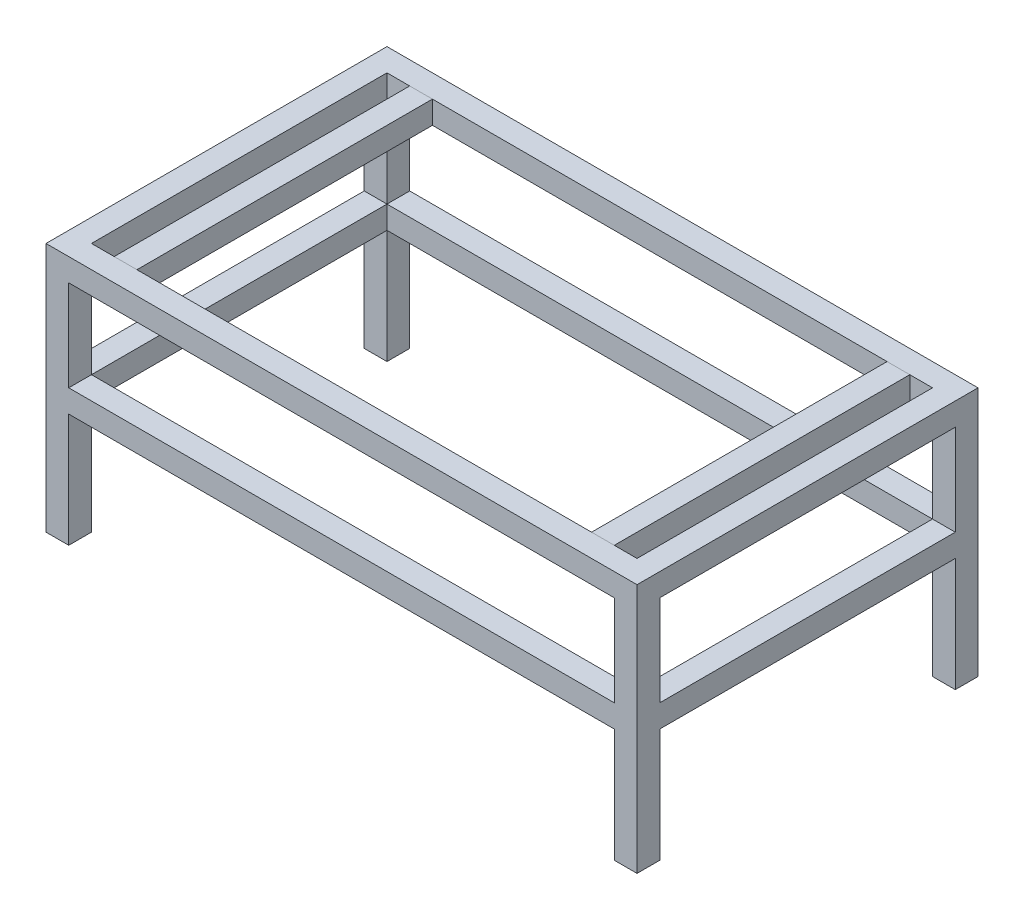
from build123d import *

# Parameters (mm, degrees)
ESQUISSE1_W             = 1300
ESQUISSE1_H             = 750
ESQUISSE1_W_2           = 1200
ESQUISSE1_H_2           = 650
BOSS_EXTRU_1_DEPTH      = 550
ESQUISSE2_W             = 1200
ESQUISSE2_H             = 200
ESQUISSE2_H_2           = 250
ENL_V_MAT_EXTRU_1_DEPTH = 1599.436736315
ESQUISSE3_W             = 650
ESQUISSE3_H             = 200
ESQUISSE3_H_2           = 250
ENL_V_MAT_EXTRU_2_DEPTH = 1599.436736315
ESQUISSE4_W             = 50
ESQUISSE4_H             = 650
BOSS_EXTRU_2_DEPTH      = 50
BOSS_EXTRU_2_2_DEPTH    = 50


with BuildPart() as part:
    # Esquisse1 → Boss.-Extru.1 (new body)
    with BuildSketch(Plane(origin=(0, 0, 0), x_dir=(1, 0, 0), z_dir=(0, 1, 0))):
        with Locations((650, 375)):
            Rectangle(ESQUISSE1_W, ESQUISSE1_H)
        with Locations((650, 375)):
            Rectangle(ESQUISSE1_W_2, ESQUISSE1_H_2, mode=Mode.SUBTRACT)
    extrude(amount=-BOSS_EXTRU_1_DEPTH)

    # Esquisse2 → Enlèv. mat.-Extru.1 (cut, through all)
    with BuildSketch(Plane.XY):
        with Locations((650, -150)):
            Rectangle(ESQUISSE2_W, ESQUISSE2_H)
        with Locations((650, -425)):
            Rectangle(ESQUISSE2_W, ESQUISSE2_H_2)
    extrude(amount=-ENL_V_MAT_EXTRU_1_DEPTH, mode=Mode.SUBTRACT)

    # Esquisse3 → Enlèv. mat.-Extru.2 (cut, through all)
    with BuildSketch(Plane.ZY):
        with Locations((-375, -150)):
            Rectangle(ESQUISSE3_W, ESQUISSE3_H)
        with Locations((-375, -425)):
            Rectangle(ESQUISSE3_W, ESQUISSE3_H_2)
    extrude(amount=-ENL_V_MAT_EXTRU_2_DEPTH, mode=Mode.SUBTRACT)


with BuildPart() as body_2:
    # Esquisse4 → Boss.-Extru.2 (new body)
    with BuildSketch(Plane(origin=(0, 0, 0), x_dir=(1, 0, 0), z_dir=(0, 1, 0))):
        with Locations((125, 375)):
            Rectangle(ESQUISSE4_W, ESQUISSE4_H)
    extrude(amount=-BOSS_EXTRU_2_DEPTH)


with BuildPart() as body_3:
    # Esquisse4 → Boss.-Extru.2 2 (new body)
    with BuildSketch(Plane(origin=(0, 0, 0), x_dir=(1, 0, 0), z_dir=(0, 1, 0))):
        with Locations((1175, 375)):
            Rectangle(ESQUISSE4_W, ESQUISSE4_H)
    extrude(amount=-BOSS_EXTRU_2_2_DEPTH)


solid = Compound([part.part, body_2.part, body_3.part])
